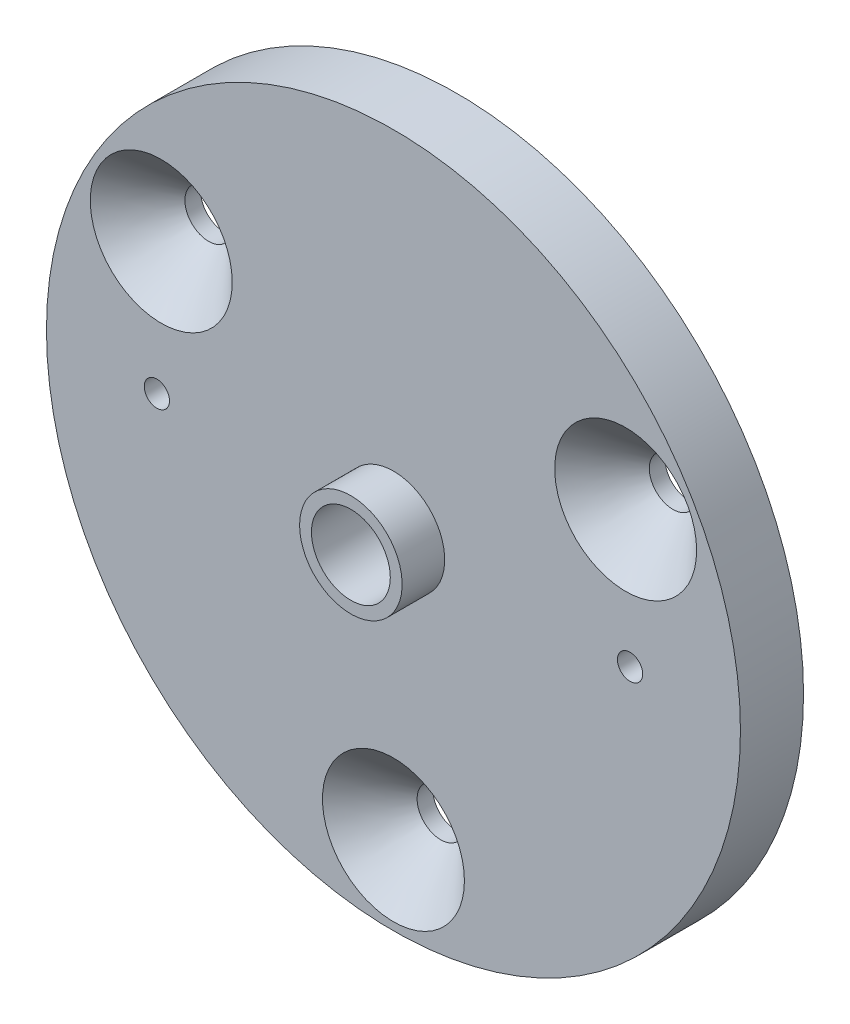
from build123d import *

# Parameters (mm, degrees)
SKETCH_1_R          = 22
EXTRUDE_1_DEPTH     = 4
SKETCH_2_R          = 3.25
EXTRUDE_2_DEPTH     = 2.7
SKETCH_3_R          = 2.5
CUT_EXTRUDE_1_DEPTH = 32.825932822
SKETCH_4_R          = 0.8
CUT_EXTRUDE_2_DEPTH = 32.368774283
SKETCH_5_R          = 13
CUT_EXTRUDE_3_DEPTH = 2.2
SKETCH_6_R          = 1.5
CUT_EXTRUDE_4_DEPTH = 32.368774283
CHAMFER_1_SIZE      = 3


with BuildPart() as part:
    # Эскиз1 → Бобышка-Вытянуть1 (new body)
    with BuildSketch(Plane.XY):
        Circle(SKETCH_1_R)
    extrude(amount=EXTRUDE_1_DEPTH)

    # Эскиз2 → Бобышка-Вытянуть2 (add)
    with BuildSketch(Plane.XY.offset(4)):
        Circle(SKETCH_2_R)
    extrude(amount=EXTRUDE_2_DEPTH)

    # Эскиз3 → Вырез-Вытянуть1 (cut, through all)
    with BuildSketch(Plane.XY.offset(6.7)):
        Circle(SKETCH_3_R)
    extrude(amount=-CUT_EXTRUDE_1_DEPTH, mode=Mode.SUBTRACT)

    # Эскиз4 → Вырез-Вытянуть2 (cut, through all)
    with BuildSketch(Plane.XY.offset(4)):
        with Locations((-15, 0)):
            Circle(SKETCH_4_R)
        with Locations((15, 0)):
            Circle(SKETCH_4_R)
    extrude(amount=-CUT_EXTRUDE_2_DEPTH, mode=Mode.SUBTRACT)

    # Эскиз5 → Вырез-Вытянуть3 (cut)
    with BuildSketch(Plane(origin=(0, 0, 0), x_dir=(-1, 0, 0), z_dir=(0, 0, -1))):
        Circle(SKETCH_5_R)
    extrude(amount=-CUT_EXTRUDE_3_DEPTH, mode=Mode.SUBTRACT)

    # Эскиз6 → Вырез-Вытянуть4 (cut, through all)
    with BuildSketch(Plane.XY.offset(4)):
        with Locations((0, -17)):
            Circle(SKETCH_6_R)
        with Locations((-14.722431864, 8.5)):
            Circle(SKETCH_6_R)
        with Locations((14.722431864, 8.5)):
            Circle(SKETCH_6_R)
    extrude(amount=-CUT_EXTRUDE_4_DEPTH, mode=Mode.SUBTRACT)

    # Фаска1
    chamfer_1_edges = [part.edges().sort_by_distance(p)[0] for p in [
        (-1.5, -17, 4),
        (13.222431864, 8.5, 4),
        (-16.222431864, 8.5, 4),
    ]]
    chamfer(chamfer_1_edges, length=CHAMFER_1_SIZE)


solid = part.part
